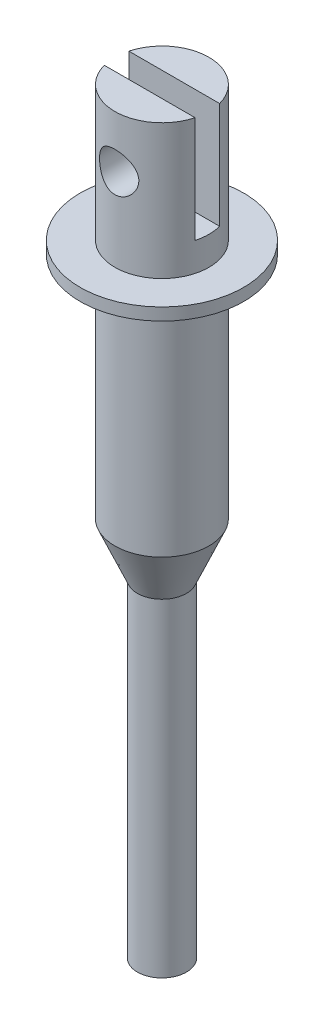
from build123d import *

# Parameters (mm, degrees)
CUT_EXTRUDE1_DEPTH      = 47.428372252
CUT_EXTRUDE1_DEPTH_BACK = 47.428372252
SKETCH2_R               = 1.2
SKETCH3_W               = 5.75
SKETCH3_H               = 1.5
CUT_EXTRUDE2_DEPTH      = 6.5
SKETCH4_R               = 5
BOSS_EXTRUDE1_DEPTH     = 0.75


with BuildPart() as part:
    # Sketch1 → Revolve1 (revolve)
    with BuildSketch(Plane.XY):
        Polygon((0, 0), (1.5, 0), (1.5, 20.05), (2.875, 23.25), (2.875, 46.25), (0, 46.25), align=None)
    revolve(axis=Axis((0, 46.25, 0), (0, -1, 0)))

    # Sketch2 → Cut-Extrude1 (cut, two sides: drawn at the far end of the back side and taken through both)
    with BuildSketch(Plane.XY.offset(-CUT_EXTRUDE1_DEPTH_BACK)):
        with Locations((0, 43.05)):
            Circle(SKETCH2_R)
    extrude(amount=CUT_EXTRUDE1_DEPTH + CUT_EXTRUDE1_DEPTH_BACK, mode=Mode.SUBTRACT)

    # Sketch3 → Cut-Extrude2 (cut)
    with BuildSketch(Plane(origin=(0, 46.25, 0), x_dir=(1, 0, 0), z_dir=(0, 1, 0))):
        Rectangle(SKETCH3_W, SKETCH3_H)
    extrude(amount=-CUT_EXTRUDE2_DEPTH, mode=Mode.SUBTRACT)

    # Sketch4 → Boss-Extrude1 (add)
    with BuildSketch(Plane(origin=(0, 37.25, 0), x_dir=(1, 0, 0), z_dir=(0, 1, 0))):
        Circle(SKETCH4_R)
    extrude(amount=BOSS_EXTRUDE1_DEPTH)


solid = part.part
